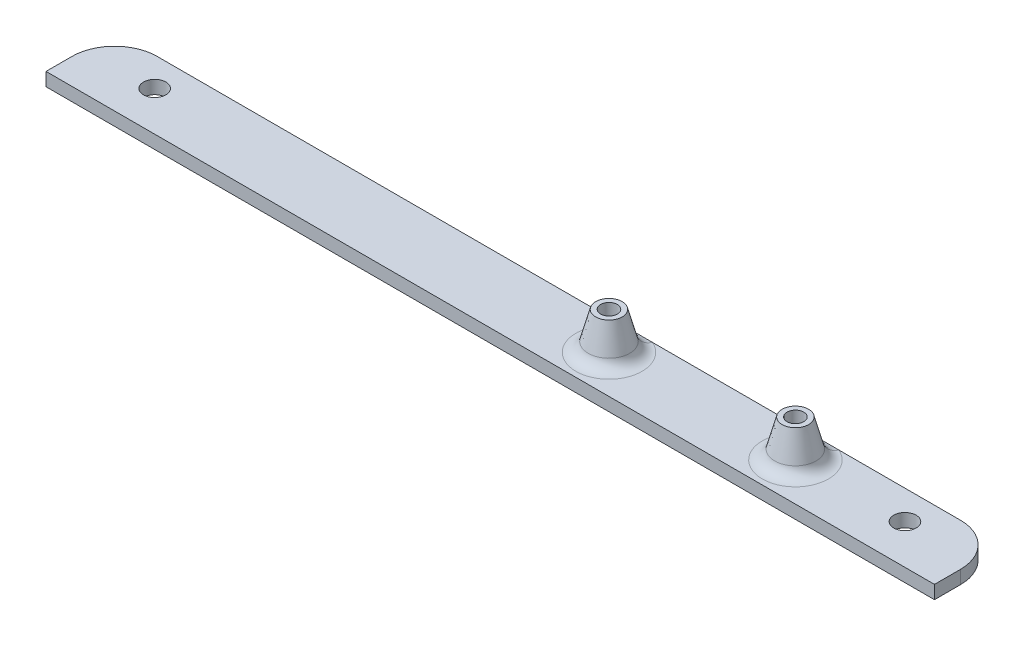
from build123d import *

# Parameters (mm, degrees)
BACKPLANE_W             = 212.09
BACKPLANE_H             = 226.06
BACKPLANE_R             = 2.667
BACKPLANE_EXTRUDE_DEPTH = 3.175
BACKPLANE_FILLETS_R     = 10.16
PROTOBOARD1_R           = 5.5499
PROTOBOARD1_R_2         = 1.9939
BOSS_EXTRUDE2_DEPTH     = 8.89
DRAFT1_ANGLE            = 15
FILLET5_R               = 3.048
PROTOBOARD2_R           = 5.5499
PROTOBOARD2_R_2         = 1.9939
BOSS_EXTRUDE3_DEPTH     = 8.89
DRAFT2_ANGLE            = 15
FILLET6_R               = 3.048
ADS1256_R               = 5.5499
ADS1256_R_2             = 1.9939
BOSS_EXTRUDE4_DEPTH     = 8.89
DRAFT3_ANGLE            = 15
FILLET7_R               = 3.048
F_3V_BUCK_R             = 5.5499
F_3V_BUCK_R_2           = 1.9939
BOSS_EXTRUDE5_DEPTH     = 8.89
DRAFT4_ANGLE            = 15
FILLET8_R               = 3.048
RELAY_R                 = 5.5499
RELAY_R_2               = 1.9939
BOSS_EXTRUDE6_DEPTH     = 8.89
DRAFT5_ANGLE            = 15
FILLET9_R               = 3.048
SERVOBOARD_R            = 5.5499
SERVOBOARD_R_2          = 1.9939
BOSS_EXTRUDE7_DEPTH     = 8.89
DRAFT6_ANGLE            = 15
FILLET10_R              = 3.048
NUCLEO_R                = 5.5499
NUCLEO_R_2              = 1.9939
BOSS_EXTRUDE8_DEPTH     = 8.89
DRAFT7_ANGLE            = 15
FILLET11_R              = 3.048
SKETCH1_OUTSIDE_W       = 276.132
SKETCH1_OUTSIDE_H       = 290.102
SKETCH1_OUTSIDE_W_2     = 219.528279984
SKETCH1_OUTSIDE_H_2     = 24.666098875
CUT_EXTRUDE1_DEPTH      = 25.4


with BuildPart() as part:
    # Backplane → Backplane_Extrude (new body)
    with BuildSketch(Plane(origin=(0, 0, 0), x_dir=(1, 0, 0), z_dir=(0, 1, 0))):
        Rectangle(BACKPLANE_W, BACKPLANE_H)
        with Locations((-89.5477, 106.114051497)):
            Circle(BACKPLANE_R, mode=Mode.SUBTRACT)
        with Locations((89.5477, 106.114051497)):
            Circle(BACKPLANE_R, mode=Mode.SUBTRACT)
    extrude(amount=-BACKPLANE_EXTRUDE_DEPTH)

    # Backplane_Fillets
    backplane_fillets_edges = [part.edges().sort_by_distance(p)[0] for p in [
        (106.045, -1.5875, 113.03),
        (-106.045, -1.5875, 113.03),
        (106.045, -1.5875, -113.03),
        (-106.045, -1.5875, -113.03),
    ]]
    fillet(backplane_fillets_edges, radius=BACKPLANE_FILLETS_R)

    # Protoboard1 → Boss-Extrude2 (add)
    # profile 1 of 2: a face of its own
    with BuildSketch(Plane(origin=(0, 0, 0), x_dir=(1, 0, 0), z_dir=(0, 1, 0))):
        with Locations((-94.477155088, 49.182704314)):
            Circle(PROTOBOARD1_R)
        with Locations((-94.477155088, 49.182704314)):
            Circle(PROTOBOARD1_R_2, mode=Mode.SUBTRACT)
    # profile 2 of 2: a face of its own
    with BuildSketch(Plane(origin=(0, 0, 0), x_dir=(1, 0, 0), z_dir=(0, 1, 0))):
        with Locations((55.560644912, 49.182704314)):
            Circle(PROTOBOARD1_R)
        with Locations((55.560644912, 49.182704314)):
            Circle(PROTOBOARD1_R_2, mode=Mode.SUBTRACT)
    extrude(amount=BOSS_EXTRUDE2_DEPTH)

    # Draft1
    draft1_faces = [part.faces().sort_by_distance(p)[0] for p in [
        (50.010744912, 4.445, -49.182704314),
        (-100.027055088, 4.445, -49.182704314),
    ]]
    draft(draft1_faces, Plane.ZX, DRAFT1_ANGLE)

    # Fillet5
    fillet5_edges = [part.edges().sort_by_distance(p)[0] for p in [
        (50.010744912, 0, -49.182704314),
        (-100.027055088, 0, -49.182704314),
    ]]
    fillet(fillet5_edges, radius=FILLET5_R)

    # Protoboard2 → Boss-Extrude3 (add)
    # profile 1 of 2: a face of its own
    with BuildSketch(Plane(origin=(0, 0, 0), x_dir=(1, 0, 0), z_dir=(0, 1, 0))):
        with Locations((-95.3389, -8.255)):
            Circle(PROTOBOARD2_R)
        with Locations((-95.3389, -8.255)):
            Circle(PROTOBOARD2_R_2, mode=Mode.SUBTRACT)
    # profile 2 of 2: a face of its own
    with BuildSketch(Plane(origin=(0, 0, 0), x_dir=(1, 0, 0), z_dir=(0, 1, 0))):
        with Locations((54.6989, -8.255)):
            Circle(PROTOBOARD2_R)
        with Locations((54.6989, -8.255)):
            Circle(PROTOBOARD2_R_2, mode=Mode.SUBTRACT)
    extrude(amount=BOSS_EXTRUDE3_DEPTH)

    # Draft2
    draft2_faces = [part.faces().sort_by_distance(p)[0] for p in [
        (49.149, 4.445, 8.255),
        (-100.8888, 4.445, 8.255),
    ]]
    draft(draft2_faces, Plane.ZX, DRAFT2_ANGLE)

    # Fillet6
    fillet6_edges = [part.edges().sort_by_distance(p)[0] for p in [
        (49.149, 0, 8.255),
        (-100.8888, 0, 8.255),
    ]]
    fillet(fillet6_edges, radius=FILLET6_R)

    # ADS1256 → Boss-Extrude4 (add)
    # profile 1 of 4: a face of its own
    with BuildSketch(Plane(origin=(0, 0, 0), x_dir=(1, 0, 0), z_dir=(0, 1, 0))):
        with Locations((68.129687485, -33.451693835)):
            Circle(ADS1256_R)
        with Locations((68.129687485, -33.451693835)):
            Circle(ADS1256_R_2, mode=Mode.SUBTRACT)
    # profile 2 of 4: a face of its own
    with BuildSketch(Plane(origin=(0, 0, 0), x_dir=(1, 0, 0), z_dir=(0, 1, 0))):
        with Locations((98.609687485, -33.451693835)):
            Circle(ADS1256_R)
        with Locations((98.609687485, -33.451693835)):
            Circle(ADS1256_R_2, mode=Mode.SUBTRACT)
    # profile 3 of 4: a face of its own
    with BuildSketch(Plane(origin=(0, 0, 0), x_dir=(1, 0, 0), z_dir=(0, 1, 0))):
        with Locations((68.129687485, 22.174306165)):
            Circle(ADS1256_R)
        with Locations((68.129687485, 22.174306165)):
            Circle(ADS1256_R_2, mode=Mode.SUBTRACT)
    # profile 4 of 4: a face of its own
    with BuildSketch(Plane(origin=(0, 0, 0), x_dir=(1, 0, 0), z_dir=(0, 1, 0))):
        with Locations((98.609687485, 22.174306165)):
            Circle(ADS1256_R)
        with Locations((98.609687485, 22.174306165)):
            Circle(ADS1256_R_2, mode=Mode.SUBTRACT)
    extrude(amount=BOSS_EXTRUDE4_DEPTH)

    # Draft3
    draft3_faces = [part.faces().sort_by_distance(p)[0] for p in [
        (93.059787485, 4.445, -22.174306165),
        (93.059787485, 4.445, 33.451693835),
        (62.579787485, 4.445, 33.451693835),
        (62.579787485, 4.445, -22.174306165),
    ]]
    draft(draft3_faces, Plane.ZX, DRAFT3_ANGLE)

    # Fillet7
    fillet7_edges = [part.edges().sort_by_distance(p)[0] for p in [
        (93.059787485, 0, 33.451693835),
        (93.059787485, 0, -22.174306165),
        (62.579787485, 0, -22.174306165),
        (62.579787485, 0, 33.451693835),
    ]]
    fillet(fillet7_edges, radius=FILLET7_R)

    # 3V_Buck → Boss-Extrude5 (add)
    with BuildSketch(Plane(origin=(0, 0, 0), x_dir=(1, 0, 0), z_dir=(0, 1, 0))):
        with Locations((88.21146798, 54.766566069)):
            Circle(F_3V_BUCK_R)
        with Locations((88.21146798, 54.766566069)):
            Circle(F_3V_BUCK_R_2, mode=Mode.SUBTRACT)
    extrude(amount=BOSS_EXTRUDE5_DEPTH)

    # Draft4
    draft4_faces = [part.faces().sort_by_distance(p)[0] for p in [
        (82.66156798, 4.445, -54.766566069),
    ]]
    draft(draft4_faces, Plane.ZX, DRAFT4_ANGLE)

    # Fillet8
    fillet8_edges = [part.edges().sort_by_distance(p)[0] for p in [
        (82.66156798, 0, -54.766566069),
    ]]
    fillet(fillet8_edges, radius=FILLET8_R)

    # Relay → Boss-Extrude6 (add)
    # profile 1 of 4: a face of its own
    with BuildSketch(Plane(origin=(0, 0, 0), x_dir=(1, 0, 0), z_dir=(0, 1, 0))):
        with Locations((19.216535219, 84.199904102)):
            Circle(RELAY_R)
        with Locations((19.216535219, 84.199904102)):
            Circle(RELAY_R_2, mode=Mode.SUBTRACT)
    # profile 2 of 4: a face of its own
    with BuildSketch(Plane(origin=(0, 0, 0), x_dir=(1, 0, 0), z_dir=(0, 1, 0))):
        with Locations((63.717335219, 84.199904102)):
            Circle(RELAY_R)
        with Locations((63.717335219, 84.199904102)):
            Circle(RELAY_R_2, mode=Mode.SUBTRACT)
    # profile 3 of 4: a face of its own
    with BuildSketch(Plane(origin=(0, 0, 0), x_dir=(1, 0, 0), z_dir=(0, 1, 0))):
        with Locations((19.216535219, 105.789904102)):
            Circle(RELAY_R)
        with Locations((19.216535219, 105.789904102)):
            Circle(RELAY_R_2, mode=Mode.SUBTRACT)
    # profile 4 of 4: a face of its own
    with BuildSketch(Plane(origin=(0, 0, 0), x_dir=(1, 0, 0), z_dir=(0, 1, 0))):
        with Locations((63.717335219, 105.789904102)):
            Circle(RELAY_R)
        with Locations((63.717335219, 105.789904102)):
            Circle(RELAY_R_2, mode=Mode.SUBTRACT)
    extrude(amount=BOSS_EXTRUDE6_DEPTH)

    # Draft5
    draft5_faces = [part.faces().sort_by_distance(p)[0] for p in [
        (13.666635219, 4.445, -84.199904102),
        (58.167435219, 4.445, -84.199904102),
        (58.167435219, 4.445, -105.789904102),
        (13.666635219, 4.445, -105.789904102),
    ]]
    draft(draft5_faces, Plane.ZX, DRAFT5_ANGLE)

    # Fillet9
    fillet9_edges = [part.edges().sort_by_distance(p)[0] for p in [
        (13.666635219, 0, -84.199904102),
        (58.167435219, 0, -84.199904102),
        (58.167435219, 0, -105.789904102),
        (13.666635219, 0, -105.789904102),
    ]]
    fillet(fillet9_edges, radius=FILLET9_R)

    # ServoBoard → Boss-Extrude7 (add)
    # profile 1 of 3: a face of its own
    with BuildSketch(Plane(origin=(0, 0, 0), x_dir=(1, 0, 0), z_dir=(0, 1, 0))):
        with Locations((-89.601054156, -103.3389565)):
            Circle(SERVOBOARD_R)
        with BuildLine():
            ThreePointArc((-91.188554156, -104.545389657), (-88.191153945, -101.929056289), (-90.807487312, -104.9264565))
            Line((-90.807487312, -104.9264565), (-91.188554156, -104.9264565))
            Line((-91.188554156, -104.9264565), (-91.188554156, -104.545389657))
        make_face(mode=Mode.SUBTRACT)
    # profile 2 of 3: a face of its own
    with BuildSketch(Plane(origin=(0, 0, 0), x_dir=(1, 0, 0), z_dir=(0, 1, 0))):
        with Locations((-89.601054156, -54.8757565)):
            Circle(SERVOBOARD_R)
        with Locations((-89.601054156, -54.8757565)):
            Circle(SERVOBOARD_R_2, mode=Mode.SUBTRACT)
    # profile 3 of 3: a face of its own
    with BuildSketch(Plane(origin=(0, 0, 0), x_dir=(1, 0, 0), z_dir=(0, 1, 0))):
        with Locations((-38.613679755, -69.190417722)):
            Circle(SERVOBOARD_R)
        with Locations((-38.613679755, -69.190417722)):
            Circle(SERVOBOARD_R_2, mode=Mode.SUBTRACT)
    extrude(amount=BOSS_EXTRUDE7_DEPTH)

    # Draft6
    draft6_faces = [part.faces().sort_by_distance(p)[0] for p in [
        (-95.150954156, 4.445, 54.8757565),
        (-44.163579755, 4.445, 69.190417722),
        (-95.150954156, 4.445, 103.3389565),
    ]]
    draft(draft6_faces, Plane.ZX, DRAFT6_ANGLE)

    # Fillet10
    fillet10_edges = [part.edges().sort_by_distance(p)[0] for p in [
        (-95.150954156, 0, 103.3389565),
        (-44.163579755, 0, 69.190417722),
        (-95.150954156, 0, 54.8757565),
    ]]
    fillet(fillet10_edges, radius=FILLET10_R)

    # Nucleo → Boss-Extrude8 (add)
    # profile 1 of 4: a face of its own
    with BuildSketch(Plane(origin=(0, 0, 0), x_dir=(1, 0, 0), z_dir=(0, 1, 0))):
        with Locations((73.719801758, -98.03908452)):
            Circle(NUCLEO_R)
        with BuildLine():
            Line((75.307301758, -99.245517676), (75.307301758, -99.62658452))
            Line((75.307301758, -99.62658452), (74.926234914, -99.62658452))
            ThreePointArc((74.926234914, -99.62658452), (72.309901547, -96.629184309), (75.307301758, -99.245517676))
        make_face(mode=Mode.SUBTRACT)
    # profile 2 of 4: a face of its own
    with BuildSketch(Plane(origin=(0, 0, 0), x_dir=(1, 0, 0), z_dir=(0, 1, 0))):
        with Locations((73.719801758, -49.77908452)):
            Circle(NUCLEO_R)
        with Locations((73.719801758, -49.77908452)):
            Circle(NUCLEO_R_2, mode=Mode.SUBTRACT)
    # profile 3 of 4: a face of its own
    with BuildSketch(Plane(origin=(0, 0, 0), x_dir=(1, 0, 0), z_dir=(0, 1, 0))):
        with Locations((-1.270198122, -51.04908452)):
            Circle(NUCLEO_R)
        with Locations((-1.270198122, -51.04908452)):
            Circle(NUCLEO_R_2, mode=Mode.SUBTRACT)
    # profile 4 of 4: a face of its own
    with BuildSketch(Plane(origin=(0, 0, 0), x_dir=(1, 0, 0), z_dir=(0, 1, 0))):
        with Locations((-1.270198122, -96.76908452)):
            Circle(NUCLEO_R)
        with Locations((-1.270198122, -96.76908452)):
            Circle(NUCLEO_R_2, mode=Mode.SUBTRACT)
    extrude(amount=BOSS_EXTRUDE8_DEPTH)

    # Draft7
    draft7_faces = [part.faces().sort_by_distance(p)[0] for p in [
        (68.169901758, 4.445, 98.03908452),
        (68.169901758, 4.445, 49.77908452),
        (-6.820098122, 4.445, 51.04908452),
        (-6.820098122, 4.445, 96.76908452),
    ]]
    draft(draft7_faces, Plane.ZX, DRAFT7_ANGLE)

    # Fillet11
    fillet11_edges = [part.edges().sort_by_distance(p)[0] for p in [
        (68.169901758, 0, 98.03908452),
        (68.169901758, 0, 49.77908452),
        (-6.820098122, 0, 51.04908452),
        (-6.820098122, 0, 96.76908452),
    ]]
    fillet(fillet11_edges, radius=FILLET11_R)

    # Sketch1 outside → Cut-Extrude1 (cut, symmetric)
    with BuildSketch(Plane(origin=(0, 0, 0), x_dir=(1, 0, 0), z_dir=(0, 1, 0))):
        Rectangle(SKETCH1_OUTSIDE_W, SKETCH1_OUTSIDE_H)
        with Locations((-1.233304944, 108.993324403)):
            Rectangle(SKETCH1_OUTSIDE_W_2, SKETCH1_OUTSIDE_H_2, mode=Mode.SUBTRACT)
    extrude(amount=CUT_EXTRUDE1_DEPTH, both=True, mode=Mode.SUBTRACT)


solid = part.part
